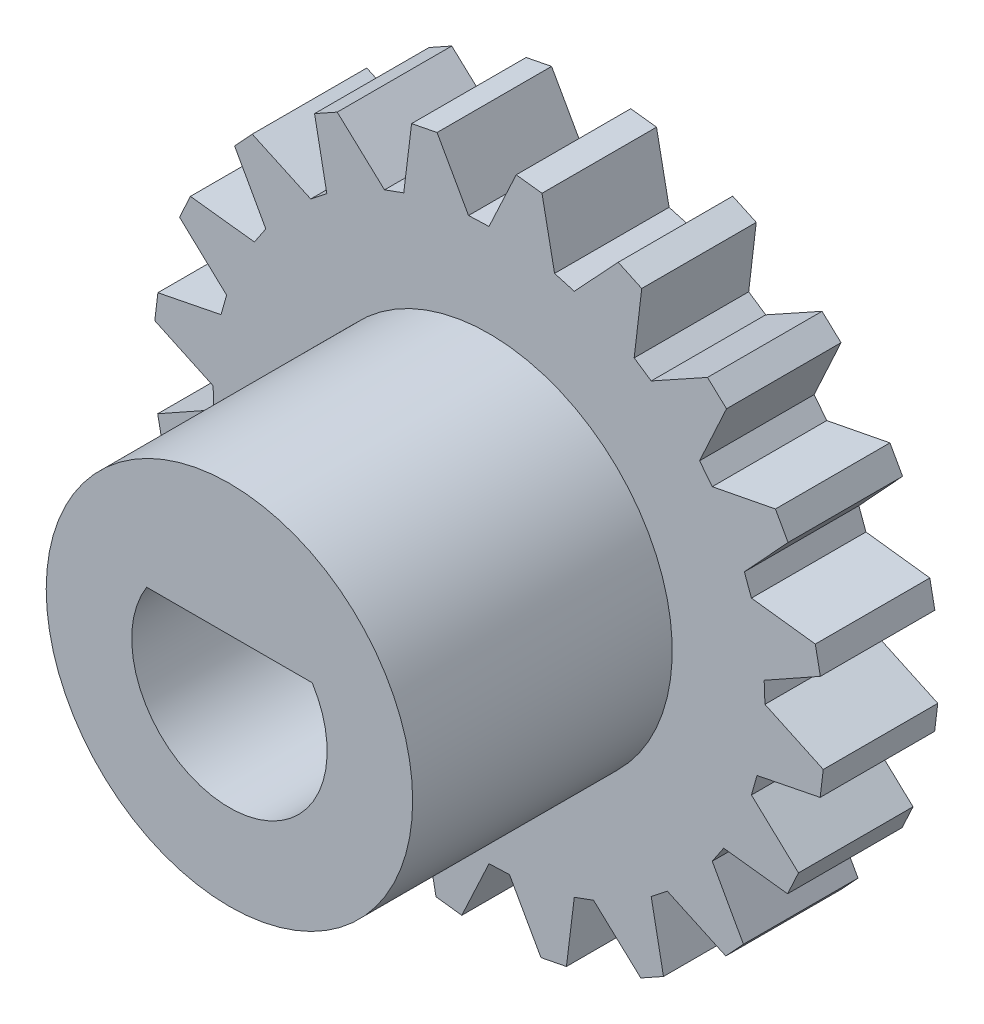
from build123d import *

# Parameters (mm, degrees)
BOSS_EXTRUDE1_DEPTH = 3750
SCALE1_SCALE        = 0.001
BOSS_EXTRUDE2_DEPTH = 3.75
SKETCH7_R           = 6
BOSS_EXTRUDE4_DEPTH = 8.5
CUT_EXTRUDE2_DEPTH  = 7.5
SKETCH9_R           = 4
CUT_EXTRUDE3_DEPTH  = 4.75


# Read off the part's stored shape, not the designer's step: Imported1
with BuildPart() as part:
    # Sketch1 → Boss-Extrude1 (new body)
    with BuildSketch(Plane.XY):
        Polygon((-1706.06803894, 17555.067062378), (-569.962084293, 15778.41758728), (-1006.988286972, 15208.873748779), (-3063.715457916, 15425.035476685), (-3388.391971588, 14641.19720459), (-1831.166863441, 13219.130516052), (-2105.892896652, 12555.883407593), (-4148.485660553, 12232.358932495), (-4259.226799011, 11391.19720459), (-2387.004852295, 10420.625686646), (-2480.708837509, 9708.873748779), (-4369.967937469, 8867.712020874), (-4259.226799011, 8026.550292969), (-2199.596881866, 7573.616504669), (-2105.892896652, 6861.864089966), (-3713.068246841, 5560.388088226), (-3388.391971588, 4776.549816132), (-1281.714439392, 4872.121334076), (-1006.988286972, 4208.873748779), (-2222.553491592, 2535.776615143), (-1706.06803894, 1862.679600716), (304.090321064, 2500.242710114), (741.116523743, 1930.699110031), (0, 0), (673.097014427, -516.485512257), (2449.747562408, 619.62044239), (3019.291162491, 182.594239712), (2803.129196167, -1874.132990837), (3586.967229843, -2198.8093853), (5009.034156799, -641.584277153), (5672.281742096, -916.310429573), (5995.805263519, -2958.903074265), (6836.967468262, -3069.644212723), (7807.538509369, -1197.422385216), (8519.290924072, -1291.12637043), (9360.452651978, -3180.385351181), (10201.615333557, -3069.644212723), (10654.54864502, -1010.014414787), (11366.300582886, -916.310429573), (12667.777061462, -2523.485660553), (13451.615333557, -2198.8093853), (13356.043815613, -92.131927609), (14019.290924072, 182.594239712), (15692.388534546, -1032.971024513), (16365.48614502, -516.485512257), (15727.922439575, 1493.672847748), (16297.466278076, 1930.699110031), (18228.164672852, 1189.582586288), (18744.649887085, 1862.679600716), (17608.543395996, 3639.330148697), (18045.570373535, 4208.873748779), (20102.296829224, 3992.711782455), (20426.973342896, 4776.549816132), (18869.749069214, 6198.616504669), (19144.47593689, 6861.864089966), (21187.06703186, 7185.388088226), (21297.80960083, 8026.550292969), (19425.586700439, 8997.120857239), (19519.290924072, 9708.873748779), (21408.550262451, 10550.035476685), (21297.80960083, 11391.19720459), (19238.178253174, 11844.130516052), (19144.47593689, 12555.883407593), (20751.649856567, 13857.358932495), (20426.973342896, 14641.19720459), (18320.297241211, 14545.625686646), (18045.570373535, 15208.873748779), (19261.135101318, 16881.971359253), (18744.649887085, 17555.067062378), (16734.491348267, 16917.505264282), (16297.466278076, 17487.049102783), (17038.581848145, 19417.747497559), (16365.48614502, 19934.232711792), (14588.834762573, 18798.126220703), (14019.290924072, 19235.153198242), (14235.452651978, 21291.879653931), (13451.615333557, 21616.556167603), (12029.54864502, 20059.331893921), (11366.300582886, 20334.056854248), (11042.777061462, 22376.649856567), (10201.615333557, 22487.392425537), (9231.043815613, 20615.169525146), (8519.290924072, 20708.873748779), (7678.129196167, 22598.133087158), (6836.967468262, 22487.392425537), (6384.034156799, 20427.761077881), (5672.281742096, 20334.056854248), (4370.805263519, 21941.232681274), (3586.967229843, 21616.556167603), (3682.538747787, 19509.880065918), (3019.291162491, 19235.153198242), (1346.194028854, 20450.717926025), (673.097014427, 19934.232711792), (1310.660123825, 17924.074172974), (741.116523743, 17487.049102783), (-1189.582586288, 18228.164672852), align=None)
    extrude(amount=BOSS_EXTRUDE1_DEPTH)


with BuildPart() as part_1:
    # Scale1: scaled about (8519.290960158, 9708.873493624, 1875)
    add(part.part.scale(SCALE1_SCALE).moved(Location((8510.771669198, 9699.16462013, 1873.125))))


with BuildPart() as body_2:
    # Sketch4 → Boss-Extrude2 (new body)
    with BuildSketch(Plane.XY.offset(1876.875)):
        Polygon((8482.082875407, 9717.46612407), (8483.52052795, 9719.007817674), (8484.291694952, 9718.650324381), (8484.044201424, 9716.556903507), (8484.601498068, 9716.182821727), (8486.44519641, 9717.204800407), (8487.06814831, 9716.626500372), (8486.185865351, 9714.712018515), (8486.600288328, 9714.184031467), (8488.669558431, 9714.586256829), (8489.083316356, 9713.843758089), (8487.65260797, 9712.295618071), (8487.883590672, 9711.665408806), (8489.975877959, 9711.40850823), (8490.139940401, 9710.574491734), (8488.300854292, 9709.544236288), (8488.325786523, 9708.873494079), (8490.236283338, 9707.982614784), (8490.134590722, 9707.138719878), (8488.067149452, 9706.727197584), (8487.883590672, 9706.081579353), (8489.425284275, 9704.64392681), (8489.067790982, 9703.872759808), (8486.974370108, 9704.120253336), (8486.600288328, 9703.562956692), (8487.622267008, 9701.71925835), (8487.043966973, 9701.09630645), (8485.129485116, 9701.978589409), (8484.601498068, 9701.564166432), (8485.00372343, 9699.494896329), (8484.26122469, 9699.081138404), (8482.713084672, 9700.51184679), (8482.082875407, 9700.280864088), (8481.825974831, 9698.188576801), (8480.991958335, 9698.024514359), (8479.961702889, 9699.863600468), (8479.29096068, 9699.838668237), (8478.400081385, 9697.928171422), (8477.556186479, 9698.029864038), (8477.144664185, 9700.097305308), (8476.499045954, 9700.280864088), (8475.061393411, 9698.739170485), (8474.290226409, 9699.096663778), (8474.537719937, 9701.190084652), (8473.980423293, 9701.564166432), (8472.136724951, 9700.542187752), (8471.513773051, 9701.120487787), (8472.39605601, 9703.034969644), (8471.981633033, 9703.562956692), (8469.91236293, 9703.16073133), (8469.498605005, 9703.90323007), (8470.929313391, 9705.451370088), (8470.698330689, 9706.081579353), (8468.606043402, 9706.338479929), (8468.44198096, 9707.172496425), (8470.281067069, 9708.202751871), (8470.256134838, 9708.873494079), (8468.345638023, 9709.764373375), (8468.447330639, 9710.608268281), (8470.514771909, 9711.019790575), (8470.698330689, 9711.665408806), (8469.156637086, 9713.103061349), (8469.514130379, 9713.874228351), (8471.607551253, 9713.626734823), (8471.981633033, 9714.184031467), (8470.959654353, 9716.027729809), (8471.537954388, 9716.650681709), (8473.452436245, 9715.76839875), (8473.980423293, 9716.182821727), (8473.578197931, 9718.25209183), (8474.320696671, 9718.665849755), (8475.868836689, 9717.235141369), (8476.499045954, 9717.46612407), (8476.75594653, 9719.558411358), (8477.589963026, 9719.7224738), (8478.620218472, 9717.883387691), (8479.29096068, 9717.908319922), (8480.181839976, 9719.818816737), (8481.025734882, 9719.71712412), (8481.437257176, 9717.649682851), align=None)
    extrude(amount=BOSS_EXTRUDE2_DEPTH)

    # Sketch7 → Boss-Extrude4 (add)
    with BuildSketch(Plane.XY.offset(1880.625)):
        with Locations(Location((8479.29096068, 9708.873494079, 0), (0, 0, 180))):
            Circle(SKETCH7_R)
    extrude(amount=BOSS_EXTRUDE4_DEPTH)

    # Sketch8 → Cut-Extrude2 (cut)
    with BuildSketch(Plane.XY.offset(1889.125)):
        with BuildLine():
            Line((8476.579872338, 9710.573494079), (8482.002049023, 9710.573494079))
            ThreePointArc((8482.002049023, 9710.573494079), (8479.29096068, 9705.673494079), (8476.579872338, 9710.573494079))
        make_face()
    extrude(amount=-CUT_EXTRUDE2_DEPTH, mode=Mode.SUBTRACT)

    # Sketch9 → Cut-Extrude3 (cut)
    with BuildSketch(Plane(origin=(0, 0, 1876.875), x_dir=(-1, 0, 0), z_dir=(0, 0, -1))):
        with Locations((-8479.29096068, 9708.873494079)):
            Circle(SKETCH9_R)
    extrude(amount=-CUT_EXTRUDE3_DEPTH, mode=Mode.SUBTRACT)


solid = body_2.part
